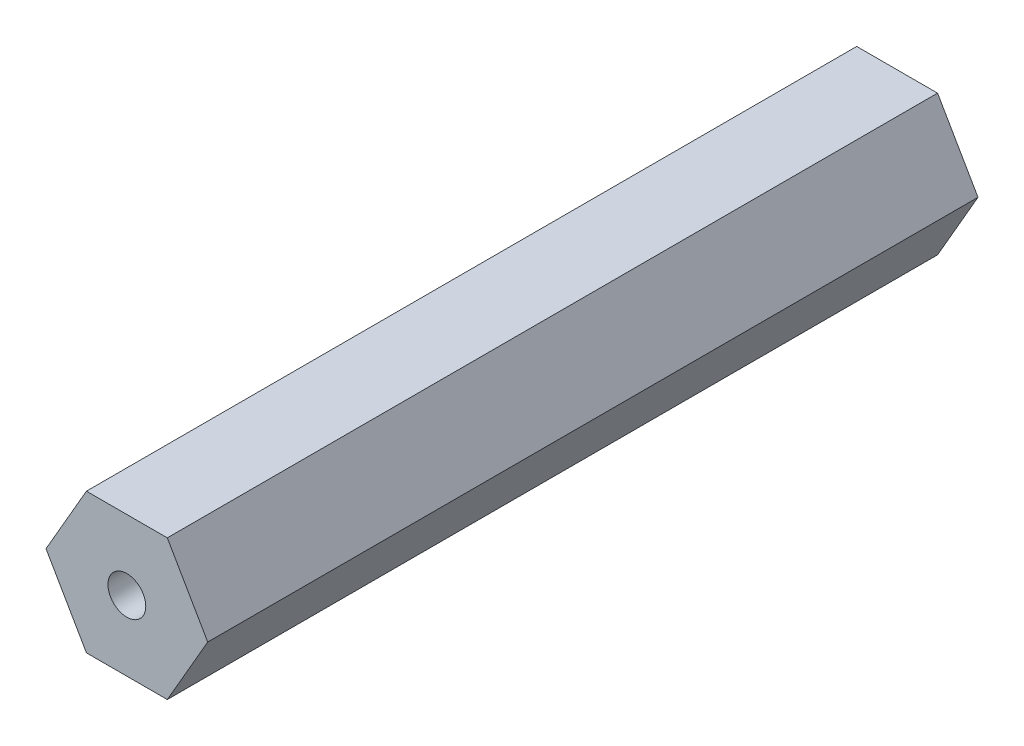
from build123d import *

# Parameters (mm, degrees)
SKETCH1_R           = 1.7145
BOSS_EXTRUDE1_DEPTH = 34.925


with BuildPart() as part:
    # Sketch1 → Boss-Extrude1 (new, symmetric)
    with BuildSketch(Plane.XY):
        Polygon((7.332348419, 0), (3.666174209, 6.35), (-3.666174209, 6.35), (-7.332348419, 0), (-3.666174209, -6.35), (3.666174209, -6.35), align=None)
        Circle(SKETCH1_R, mode=Mode.SUBTRACT)
    extrude(amount=BOSS_EXTRUDE1_DEPTH, both=True)


solid = part.part
